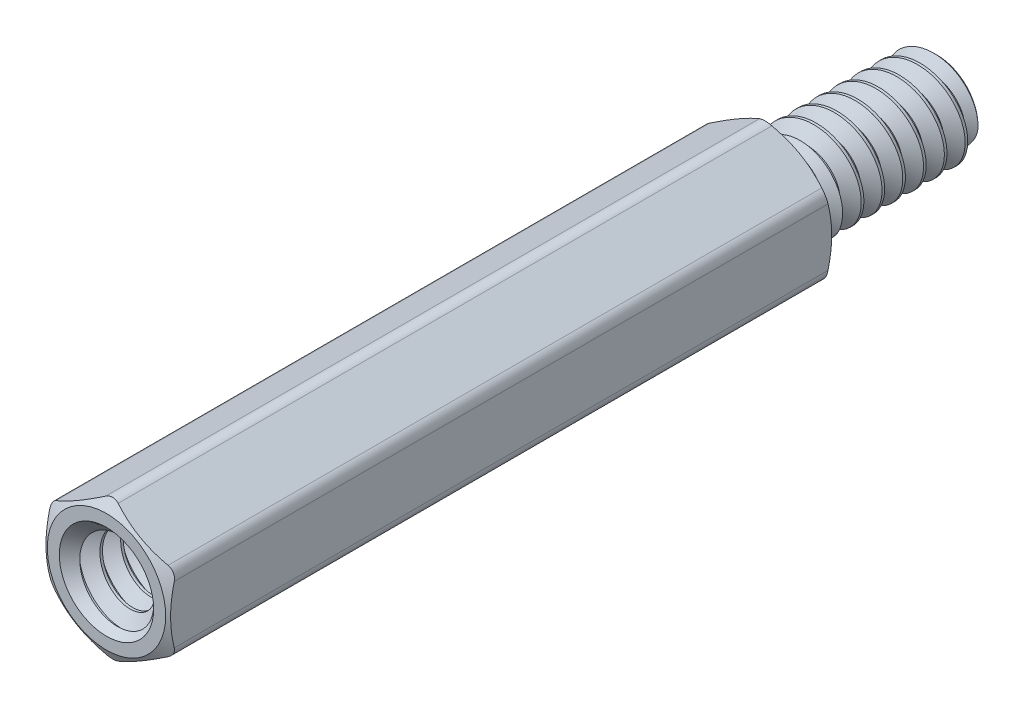
from build123d import *

# Parameters (mm, degrees)
SKETCH4_R              = 2.066925
BOSS_EXTRUDE1_DEPTH    = 25.4
SKETCH5_OUTSIDE_W      = 127.446
SKETCH5_OUTSIDE_H      = 128.184
SKETCH5_OUTSIDE_R      = 2.2621875
CUT_EXTRUDE1_DEPTH     = 32.957680146
CUT_EXTRUDE1_DRAFT     = -60
SKETCH6_OUTSIDE_W      = 105.626
SKETCH6_OUTSIDE_H      = 106.364
SKETCH6_OUTSIDE_R      = 2.2621875
CUT_EXTRUDE2_DEPTH     = 26.659127427
CUT_EXTRUDE2_DRAFT     = -60
FILLET1_R              = 0.47625
CUT_SWEEP1_PITCH       = 0.79375
CUT_SWEEP1_HEIGHT      = 6.1595
CUT_SWEEP1_RADIUS      = 1.7526
CUT_SWEEP1_START_ANGLE = 90
SKETCH9_R              = 1.9510375
BOSS_EXTRUDE2_DEPTH    = 9.525
SKETCH10_W             = 9.525
SKETCH10_H             = 1.7526
CUT_SWEEP2_PITCH       = 0.79375
CUT_SWEEP2_HEIGHT      = 10.31875
CUT_SWEEP2_RADIUS      = 1.7526
CUT_SWEEP2_START_ANGLE = 90


with BuildPart() as part:
    # Sketch3 → Revolve1 (revolve)
    with BuildSketch(Plane(origin=(0, 0, 0), x_dir=(0, 0, -1), z_dir=(1, 0, 0))):
        with BuildLine():
            Line((-15.875, 1.5541625), (-15.875, 0))
            Line((-15.875, 0), (6.35, 0))
            Line((6.35, 0), (6.35, 1.5541625))
            Line((6.35, 1.5541625), (6.1515625, 1.7526))
            Line((6.1515625, 1.7526), (1.05965625, 1.7526))
            Line((1.05965625, 1.7526), (0.762, 1.237044252))
            Line((0.762, 1.237044252), (0.1984375, 1.237044252))
            ThreePointArc((0.1984375, 1.237044252), (0.058120998, 1.29516525), (0, 1.435481752))
            Line((0, 1.435481752), (0, 2.38125))
            Line((0, 2.38125), (-25.4, 2.38125))
            Line((-25.4, 2.38125), (-25.4, 1.9510375))
            Line((-25.4, 1.9510375), (-25.2015625, 1.7526))
            Line((-25.2015625, 1.7526), (-16.0734375, 1.7526))
            Line((-16.0734375, 1.7526), (-15.875, 1.5541625))
        make_face()
    revolve(axis=Axis((0, 0, -6.35), (0, 0, 1)))

    # Sketch4 → Boss-Extrude1 (add)
    with BuildSketch(Plane.XY.offset(25.4)):
        Polygon((-2.38125, 1.374815329), (-2.38125, -1.374815329), (0, -2.749630657), (2.38125, -1.374815329), (2.38125, 1.374815329), (0, 2.749630657), align=None)
        Circle(SKETCH4_R, mode=Mode.SUBTRACT)
    extrude(amount=-BOSS_EXTRUDE1_DEPTH)


with BuildPart() as cut_extrude1_tool:
    # Sketch5 outside → Cut-Extrude1 (with draft: the straight prism first)
    with BuildSketch(Plane.XY.offset(25.4)):
        Rectangle(SKETCH5_OUTSIDE_W, SKETCH5_OUTSIDE_H)
        Circle(SKETCH5_OUTSIDE_R, mode=Mode.SUBTRACT)
    extrude(amount=-CUT_EXTRUDE1_DEPTH)
    # Cut-Extrude1: the draft: its side faces are tilted about the plane it starts from
    cut_extrude1_sides = [cut_extrude1_tool.faces().sort_by_distance(p)[0] for p in [
        (0, -64.092, 8.921159927),
        (63.723, 0, 8.921159927),
        (0, 64.092, 8.921159927),
        (-63.723, 0, 8.921159927),
        (-2.2621875, 0, 8.921159927),
    ]]
    draft(cut_extrude1_sides, Plane.XY.offset(25.4), CUT_EXTRUDE1_DRAFT)


with BuildPart() as part_1:
    add(part.part)

    # Cut-Extrude1: cut by cut_extrude1_tool
    add(cut_extrude1_tool.part, mode=Mode.SUBTRACT)


with BuildPart() as cut_extrude2_tool:
    # Sketch6 outside → Cut-Extrude2 (with draft: the straight prism first)
    with BuildSketch(Plane(origin=(0, 0, 0), x_dir=(-1, 0, 0), z_dir=(0, 0, -1))):
        Rectangle(SKETCH6_OUTSIDE_W, SKETCH6_OUTSIDE_H)
        Circle(SKETCH6_OUTSIDE_R, mode=Mode.SUBTRACT)
    extrude(amount=-CUT_EXTRUDE2_DEPTH)
    # Cut-Extrude2: the draft: its side faces are tilted about the plane it starts from
    cut_extrude2_sides = [cut_extrude2_tool.faces().sort_by_distance(p)[0] for p in [
        (0, -53.182, 13.329563713),
        (-52.813, 0, 13.329563713),
        (0, 53.182, 13.329563713),
        (52.813, 0, 13.329563713),
        (2.2621875, 0, 13.329563713),
    ]]
    draft(cut_extrude2_sides, Plane(origin=(0, 0, 0), x_dir=(-1, 0, 0), z_dir=(0, 0, -1)), CUT_EXTRUDE2_DRAFT)


with BuildPart() as part_2:
    add(part_1.part)

    # Cut-Extrude2: cut by cut_extrude2_tool
    add(cut_extrude2_tool.part, mode=Mode.SUBTRACT)

    # Fillet1
    fillet1_edges = [part_2.edges().sort_by_distance(p)[0] for p in [
        (0, 2.749630657, 12.7),
        (-2.38125, -1.374815329, 12.7),
        (0, -2.749630657, 12.7),
        (2.38125, -1.374815329, 12.7),
        (2.38125, 1.374815329, 12.7),
        (-2.38125, 1.374815329, 12.7),
    ]]
    fillet(fillet1_edges, radius=FILLET1_R)

    # Cut-Sweep1: sweep along a helix
    with BuildLine() as cut_sweep1_path:
        add(Helix(CUT_SWEEP1_PITCH, CUT_SWEEP1_HEIGHT, CUT_SWEEP1_RADIUS, center=(0, 0, -6.35), direction=(0, 0, 1), mode=Mode.PRIVATE).rotate(Axis((0, 0, -6.35), (0, 0, 1)), CUT_SWEEP1_START_ANGLE))
    # Sketch7 → Cut-Sweep1 (sweep, cut)
    with BuildSketch(Plane.ZY):
        Polygon((-6.64765625, 1.237044252), (-6.746875, 1.237044252), (-7.069335938, 1.795562979), (-6.325195312, 1.795562979), align=None)
    sweep(path=cut_sweep1_path.line, is_frenet=True, mode=Mode.SUBTRACT)

    # Sketch9 → Boss-Extrude2 (add)
    with BuildSketch(Plane.XY.offset(15.875)):
        Circle(SKETCH9_R)
    extrude(amount=BOSS_EXTRUDE2_DEPTH)


with BuildPart() as body_2:
    # Sketch10 → Revolve2 (revolve)
    with BuildSketch(Plane(origin=(0, 0, 0), x_dir=(0, 0, -1), z_dir=(1, 0, 0))):
        with Locations((-20.6375, 0.8763)):
            Rectangle(SKETCH10_W, SKETCH10_H)
    revolve(axis=Axis((0, 0, -6.35), (0, 0, 1)))

    # Cut-Sweep2: sweep along a helix
    with BuildLine() as cut_sweep2_path:
        add(Helix(CUT_SWEEP2_PITCH, CUT_SWEEP2_HEIGHT, CUT_SWEEP2_RADIUS, center=(0, 0, 25.4), direction=(0, 0, -1), mode=Mode.PRIVATE).rotate(Axis((0, 0, 25.4), (0, 0, -1)), CUT_SWEEP2_START_ANGLE))
    # Sketch12 → Cut-Sweep2 (sweep, cut)
    with BuildSketch(Plane(origin=(0, 0, 0), x_dir=(0, 0, -1), z_dir=(1, 0, 0))):
        Polygon((-25.796875, 1.237044252), (-25.69765625, 1.237044252), (-25.375195313, 1.795562979), (-26.119335938, 1.795562979), align=None)
    sweep(path=cut_sweep2_path.line, is_frenet=True, mode=Mode.SUBTRACT)


with BuildPart() as part_3:
    add(part_2.part)

    # Combine1: cut body 2
    add(body_2.part, mode=Mode.SUBTRACT)

    # Cut-Extrude3 cone 1 section (through the dimple's axis) → Cut-Extrude3 (revolve, cut)
    with BuildSketch(Plane(origin=(0, 0, 25.4), x_dir=(0, -1, 0), z_dir=(1, 0, 0))):
        Polygon((0, 0), (1.8034, 0), (0, 1.8034), align=None)
    revolve(axis=Axis((0, 0, 25.4), (0, 0, -1)), mode=Mode.SUBTRACT)


solid = part_3.part
